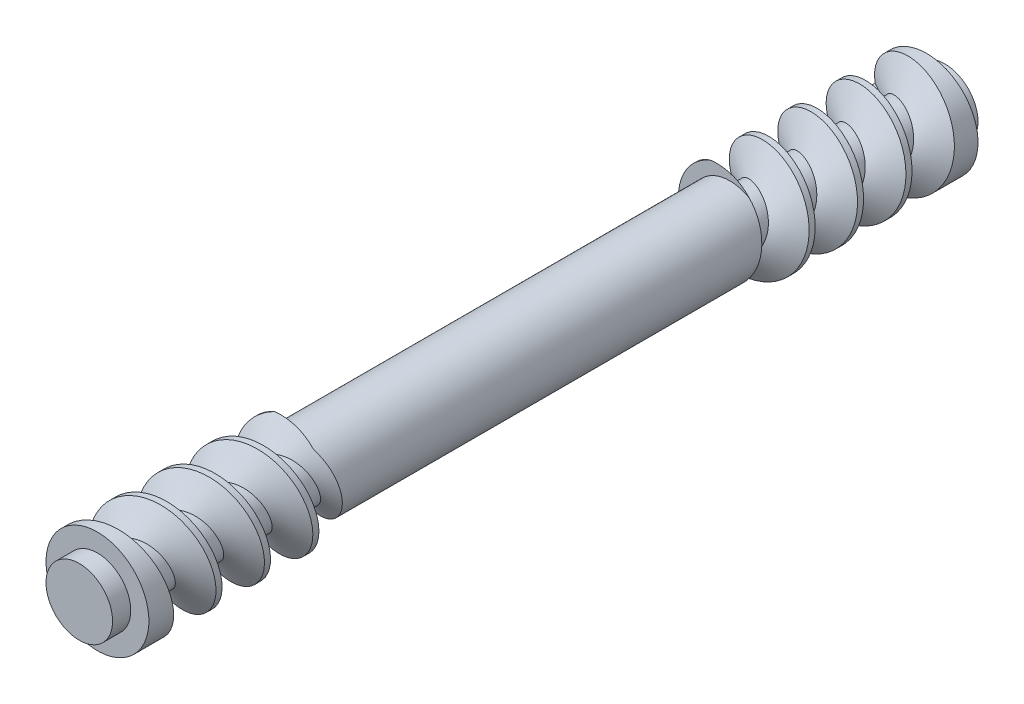
from build123d import *

# Parameters (mm, degrees)
ESQUISSE1_R             = 4.25
BOSS_EXTRU_1_DEPTH      = 34.25
ESQUISSE3_R             = 2.75
BOSS_EXTRU_2_DEPTH      = 1.5
FILETAGE1_PITCH         = 4
ENL_V_START             = 18
ESQUISSE4_R             = 4.25
ESQUISSE4_R_2           = 3.25
ENL_V_MAT_EXTRU_2_DEPTH = 18


with BuildPart() as part:
    # Esquisse1 → Boss.-Extru.1 (new, symmetric)
    with BuildSketch(Plane.XY):
        Circle(ESQUISSE1_R)
    extrude(amount=BOSS_EXTRU_1_DEPTH, both=True)

    # Esquisse3 → Boss.-Extru.2 (add)
    with BuildSketch(Plane.XY.offset(34.25)):
        Circle(ESQUISSE3_R)
    boss_extru_2 = extrude(amount=BOSS_EXTRU_2_DEPTH)

    # Symétrie1: Boss.-Extru.2 across plane
    add(boss_extru_2.mirror(Plane.XY))

    # Filetage1: the profile of Profil de filetage1 profile screwed along a right-hand helix of 3.75 turns, 12 arcs to a turn; built about Z, then put on its axis
    filetage1_z = Axis((0, 0, 0), (0, 0, 1))
    filetage1_corners = [(4.2503, 0, -0.000173205), (4.2503, 0, 3.500173194), (2.0849365, 0, 2.249999995), (2.0849365, 0, 1.249999995)]
    with BuildLine(mode=Mode.PRIVATE) as filetage1_profile:
        Line(filetage1_corners[0], filetage1_corners[1])
        Line(filetage1_corners[1], filetage1_corners[2])
        Line(filetage1_corners[2], filetage1_corners[3])
        Line(filetage1_corners[3], filetage1_corners[0])
    filetage1_cap = Face(filetage1_profile.wire())
    filetage1_turn_angles = [0, 15, 30, 45, 60, 75, 90, 105, 120, 135, 150, 165, 180, 195, 210, 225, 240, 255, 270, 285, 300, 315, 330, 345, 360]
    filetage1_turn_weights = [1, 0.9659258262890683, 1, 0.9659258262890683, 1, 0.9659258262890683, 1, 0.9659258262890683, 1, 0.9659258262890683, 1, 0.9659258262890683, 1, 0.9659258262890683, 1, 0.9659258262890683, 1, 0.9659258262890683, 1, 0.9659258262890683, 1, 0.9659258262890683, 1, 0.9659258262890683, 1]
    filetage1_turn_rails = [Edge.make_bspline([Vector(p[0], p[1], 0).rotate(filetage1_z, filetage1_turn_angles[k]) / filetage1_turn_weights[k] + Vector(0, 0, p[2] + FILETAGE1_PITCH * filetage1_turn_angles[k] / 360) for k in range(25)], [0, 0, 0, 1, 1, 2, 2, 3, 3, 4, 4, 5, 5, 6, 6, 7, 7, 8, 8, 9, 9, 10, 10, 11, 11, 12, 12, 12], 2, filetage1_turn_weights) for p in filetage1_corners]
    filetage1_turn_sides = [Face.make_surface_from_curves(filetage1_turn_rails[p[0]], filetage1_turn_rails[p[1]]) for p in [(0, 1), (1, 2), (2, 3), (3, 0)]]
    filetage1_last_angles = [1080, 1095, 1110, 1125, 1140, 1155, 1170, 1185, 1200, 1215, 1230, 1245, 1260, 1275, 1290, 1305, 1320, 1335, 1350]
    filetage1_last_weights = [1, 0.9659258262890683, 1, 0.9659258262890683, 1, 0.9659258262890683, 1, 0.9659258262890683, 1, 0.9659258262890683, 1, 0.9659258262890683, 1, 0.9659258262890683, 1, 0.9659258262890683, 1, 0.9659258262890683, 1]
    filetage1_last_rails = [Edge.make_bspline([Vector(p[0], p[1], 0).rotate(filetage1_z, filetage1_last_angles[k]) / filetage1_last_weights[k] + Vector(0, 0, p[2] + FILETAGE1_PITCH * filetage1_last_angles[k] / 360) for k in range(19)], [0, 0, 0, 1, 1, 2, 2, 3, 3, 4, 4, 5, 5, 6, 6, 7, 7, 8, 8, 9, 9, 9], 2, filetage1_last_weights) for p in filetage1_corners]
    filetage1_last_sides = [Face.make_surface_from_curves(filetage1_last_rails[p[0]], filetage1_last_rails[p[1]]) for p in [(0, 1), (1, 2), (2, 3), (3, 0)]]
    filetage1 = Plane(origin=(0, 0, 34.25), x_dir=(-1, 0, 0), z_dir=(0, 0, -1)) * Solid(Shell([*[p.moved(Location((0, 0, FILETAGE1_PITCH * i))) for i in range(3) for p in filetage1_turn_sides], *filetage1_last_sides, filetage1_cap, filetage1_cap.rotate(filetage1_z, 1350).moved(Location((0, 0, FILETAGE1_PITCH * 1350 / 360)))]))
    add(filetage1, mode=Mode.SUBTRACT)

    # Symétrie4: Filetage1 across plane
    add(filetage1.mirror(Plane.XY), mode=Mode.SUBTRACT)

    # Esquisse4 → Enlèv. mat.-Extru.2 (cut)
    with BuildSketch(Plane.XY.offset(ENL_V_START)):
        with Locations(Location((0, 0, 0), (0, 0, 180))):
            Circle(ESQUISSE4_R)
        with Locations(Location((0, 0, 0), (0, 0, 270))):
            Circle(ESQUISSE4_R_2, mode=Mode.SUBTRACT)
    enl_v_mat_extru_2 = extrude(amount=-ENL_V_MAT_EXTRU_2_DEPTH, mode=Mode.SUBTRACT)

    # Symétrie5: Enlèv. mat.-Extru.2 across plane
    add(enl_v_mat_extru_2.mirror(Plane.XY), mode=Mode.SUBTRACT)


solid = part.part
